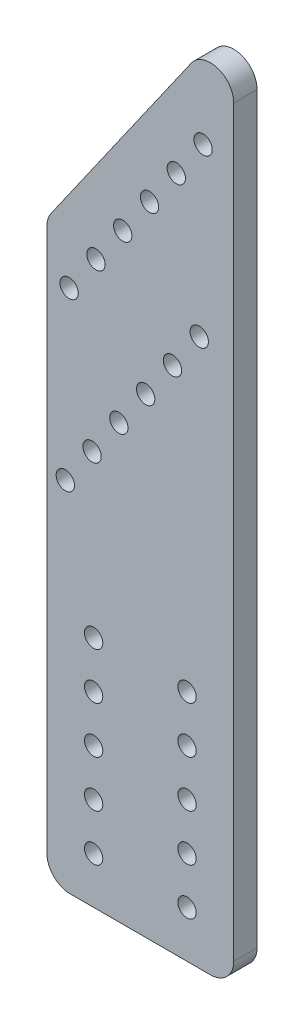
from build123d import *

# Parameters (mm, degrees)
BOSS_EXTRUDE1_DEPTH = 6.35
SKETCH2_R           = 2.4892
CUT_EXTRUDE1_DEPTH  = 235.26250767
FILLET1_R           = 6.35


with BuildPart() as part:
    # Sketch1 → Boss-Extrude1 (new body)
    with BuildSketch(Plane.XY):
        Polygon((0, 156.050081258), (50.8, 228.6), (50.8, 0), (0, 0), align=None)
    extrude(amount=BOSS_EXTRUDE1_DEPTH)

    # Sketch2 → Cut-Extrude1 (cut, through all)
    with BuildSketch(Plane(origin=(0, 0, 0), x_dir=(-1, 0, 0), z_dir=(0, 0, -1))):
        with Locations((-38.1, 12.7)):
            Circle(SKETCH2_R)
        with Locations((-12.7, 12.7)):
            Circle(SKETCH2_R)
        with Locations((-12.7, 25.4)):
            Circle(SKETCH2_R)
        with Locations((-38.1, 25.4)):
            Circle(SKETCH2_R)
        with Locations((-12.7, 38.1)):
            Circle(SKETCH2_R)
        with Locations((-38.1, 38.1)):
            Circle(SKETCH2_R)
        with Locations((-12.7, 50.8)):
            Circle(SKETCH2_R)
        with Locations((-38.1, 50.8)):
            Circle(SKETCH2_R)
        with Locations((-12.7, 63.5)):
            Circle(SKETCH2_R)
        with Locations((-38.1, 63.5)):
            Circle(SKETCH2_R)
        with Locations((-42.46619935, 194.556324909)):
            Circle(SKETCH2_R)
        with Locations((-35.181778608, 184.153093946)):
            Circle(SKETCH2_R)
        with Locations((-27.897357867, 173.749862984)):
            Circle(SKETCH2_R)
        with Locations((-20.612937125, 163.346632021)):
            Circle(SKETCH2_R)
        with Locations((-41.41939905, 148.777790538)):
            Circle(SKETCH2_R)
        with Locations((-13.328516383, 152.943401059)):
            Circle(SKETCH2_R)
        with Locations((-34.134978308, 138.374559576)):
            Circle(SKETCH2_R)
        with Locations((-6.044095642, 142.540170097)):
            Circle(SKETCH2_R)
        with Locations((-26.850557567, 127.971328613)):
            Circle(SKETCH2_R)
        with Locations((-19.566136825, 117.568097651)):
            Circle(SKETCH2_R)
        with Locations((-12.281716083, 107.164866688)):
            Circle(SKETCH2_R)
        with Locations((-4.997295342, 96.761635726)):
            Circle(SKETCH2_R)
    extrude(amount=-CUT_EXTRUDE1_DEPTH, mode=Mode.SUBTRACT)

    # Fillet1
    fillet1_edges = [part.edges().sort_by_distance(p)[0] for p in [
        (0, 156.050081258, 3.175),
        (50.8, 0, 3.175),
        (0, 0, 3.175),
        (50.8, 228.6, 3.175),
    ]]
    fillet(fillet1_edges, radius=FILLET1_R)


solid = part.part
